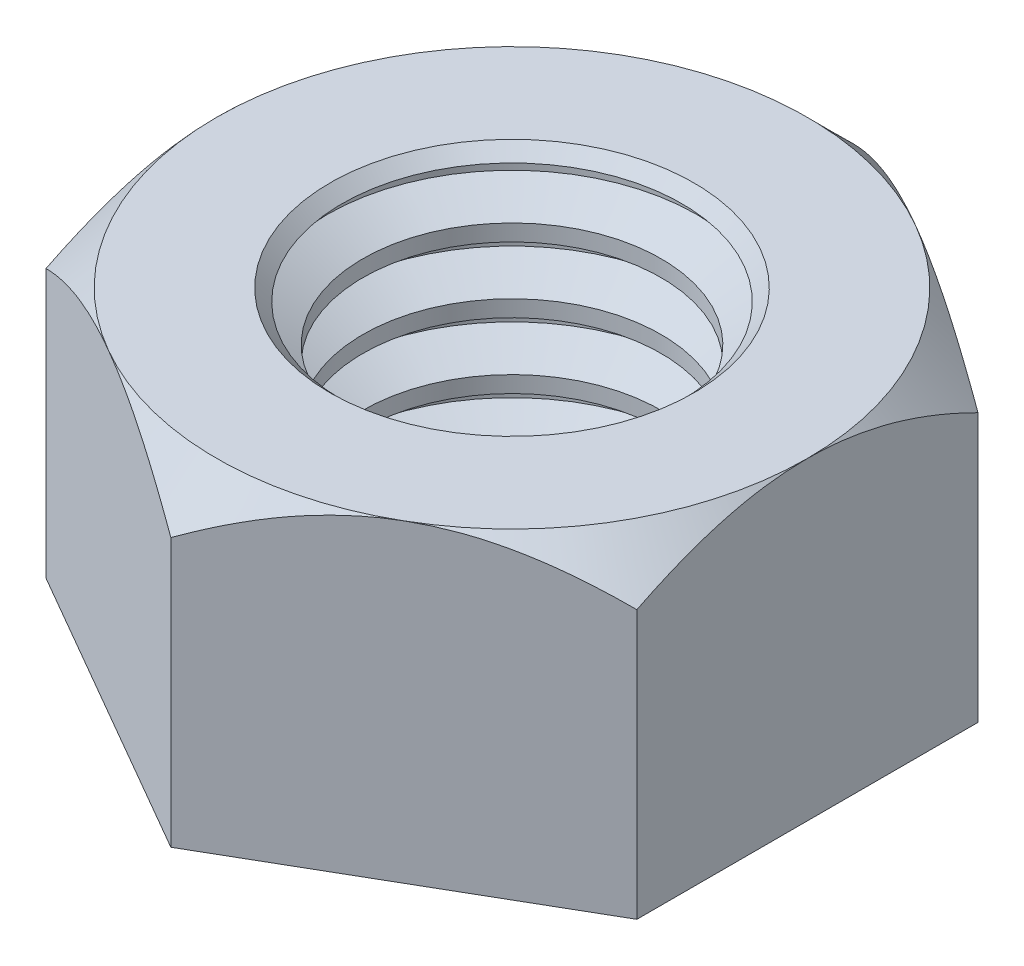
from build123d import *

# Parameters (mm, degrees)
EXTRUDE1_DEPTH  = 6.746875
LPATTERN2_COUNT = 5
LPATTERN2_PITCH = 1.411111111
CHAMFER1_SIZE   = 0.705555556
CHAMFER1_SIZE_2 = 0.516502514


with BuildPart() as part:
    # Sketch1 → Extrude1 (new body)
    with BuildSketch(Plane(origin=(0, 0, 0), x_dir=(1, 0, 0), z_dir=(0, 1, 0))):
        Polygon((0, 7.332348419), (-6.35, 3.666174209), (-6.35, -3.666174209), (0, -7.332348419), (6.35, -3.666174209), (6.35, 3.666174209), align=None)
    extrude(amount=EXTRUDE1_DEPTH)

    # Sketch3 → Cut-Revolve2 (revolve, cut)
    with BuildSketch(Plane(origin=(0, 0, 0), x_dir=(0, 0, -1), z_dir=(1, 0, 0))):
        Polygon((6.35, 6.746875), (7.332348419, 5.764526581), (7.332348419, 6.746875), align=None)
    revolve(axis=Axis((0, 0.541995889, 0), (0, -1, 0)), mode=Mode.SUBTRACT)

    # Sketch2 → Cut-Revolve1 (revolve, cut)
    with BuildSketch(Plane.XY, mode=Mode.PRIVATE) as cut_revolve1_sk:
        Polygon((0, 6.746875), (3.204963706, 6.746875), (3.96875, 6.305902778), (3.96875, 6.129513889), (3.204963706, 5.688541667), (3.204963706, 5.335763889), (0, 5.335763889), align=None)
    cut_revolve1 = revolve(cut_revolve1_sk.sketch.rotate(Axis((0, 1.663578541, 0), (0, -1, 0)), 90), axis=Axis((0, 1.663578541, 0), (0, -1, 0)), mode=Mode.SUBTRACT)

    # LPattern2: Cut-Revolve1 ×5
    with Locations(*[(0, -i * LPATTERN2_PITCH, 0) for i in range(1, LPATTERN2_COUNT)]):
        add(cut_revolve1, mode=Mode.SUBTRACT)

    # Chamfer1
    # the kernel refuses this chamfer: 0.705555556, 0.516502514 mm, written as the material it takes off along each edge
    with BuildSketch(Plane(origin=(0, 6.746875, 0), x_dir=(0, 0, 1), z_dir=(1, 0, 0))) as chamfer1_piece_1:
        Polygon((3.204963706 + CHAMFER1_SIZE, 0), (3.204963706 + CHAMFER1_SIZE_2 * 0.866025404169, CHAMFER1_SIZE_2 * 0.500000000222), (3.204963706, 0), align=None)
    revolve(axis=Axis((0, 6.746875, 0), (0, -1, 0)), mode=Mode.SUBTRACT)


solid = part.part
